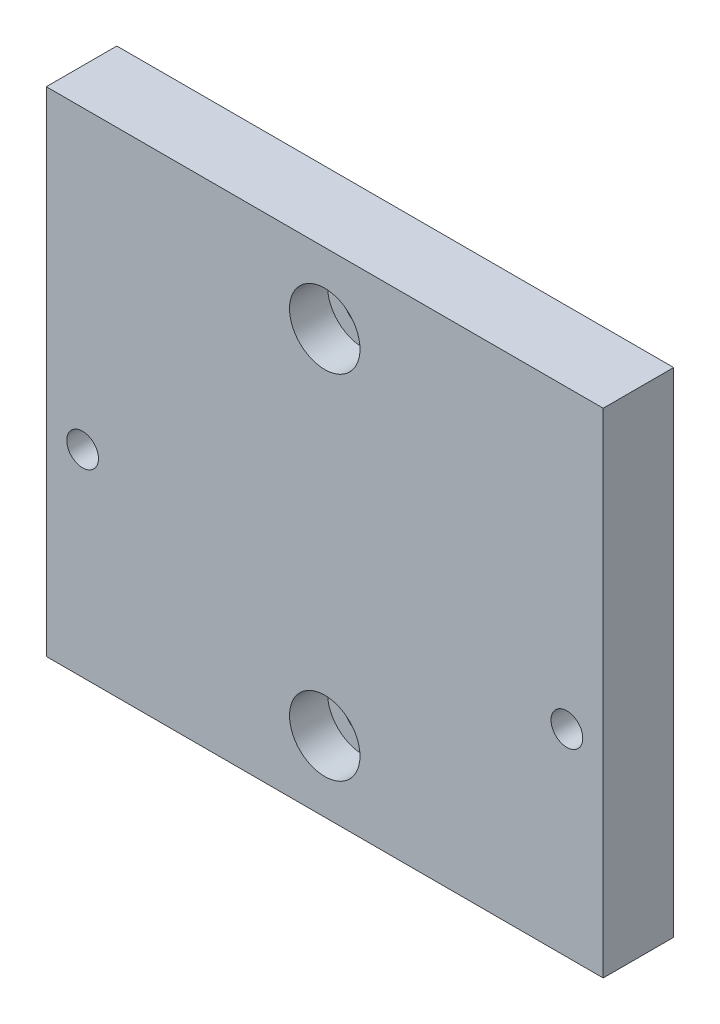
from build123d import *

# Parameters (mm, degrees)
SKETCH1_W                                       = 79
SKETCH1_H                                       = 70
BOSS_EXTRUDE1_DEPTH                             = 10
M4_CLEARANCE_HOLE1_D                            = 4.5
CUT_EXTRUDE3_DEPTH                              = 3.5
CBORE_FOR_M5_SOCKET_HEAD_CAP_SCREW1_D           = 5.5
CBORE_FOR_M5_SOCKET_HEAD_CAP_SCREW1_CBORE_D     = 10
CBORE_FOR_M5_SOCKET_HEAD_CAP_SCREW1_CBORE_DEPTH = 5.4


with BuildPart() as part:
    # Sketch1 → Boss-Extrude1 (new body)
    with BuildSketch(Plane.XY):
        with Locations((39.5, 35)):
            Rectangle(SKETCH1_W, SKETCH1_H)
    extrude(amount=BOSS_EXTRUDE1_DEPTH)

    # M4 Clearance Hole1 (through all)
    with Locations(Plane.XY.offset(10)):
        with Locations((5.15, 28), (73.85, 28)):
            Hole(M4_CLEARANCE_HOLE1_D / 2)

    # Sketch11 → Cut-Extrude3 (cut)
    with BuildSketch(Plane(origin=(0, 0, 0), x_dir=(-1, 0, 0), z_dir=(0, 0, -1))):
        Polygon((-69.635343035, 28), (-71.742671517, 31.65), (-75.957328483, 31.65), (-78.064656965, 28), (-75.957328483, 24.35), (-71.742671517, 24.35), align=None)
        Polygon((-9.364656965, 28), (-7.257328483, 24.35), (-3.042671517, 24.35), (-0.935343035, 28), (-3.042671517, 31.65), (-7.257328483, 31.65), align=None)
    extrude(amount=-CUT_EXTRUDE3_DEPTH, mode=Mode.SUBTRACT)

    # CBORE for M5 Socket Head Cap Screw1 (through all)
    with Locations(Plane.XY.offset(10)):
        with Locations((39.5, 60), (39.5, 10)):
            CounterBoreHole(CBORE_FOR_M5_SOCKET_HEAD_CAP_SCREW1_D / 2, CBORE_FOR_M5_SOCKET_HEAD_CAP_SCREW1_CBORE_D / 2, CBORE_FOR_M5_SOCKET_HEAD_CAP_SCREW1_CBORE_DEPTH)


solid = part.part
